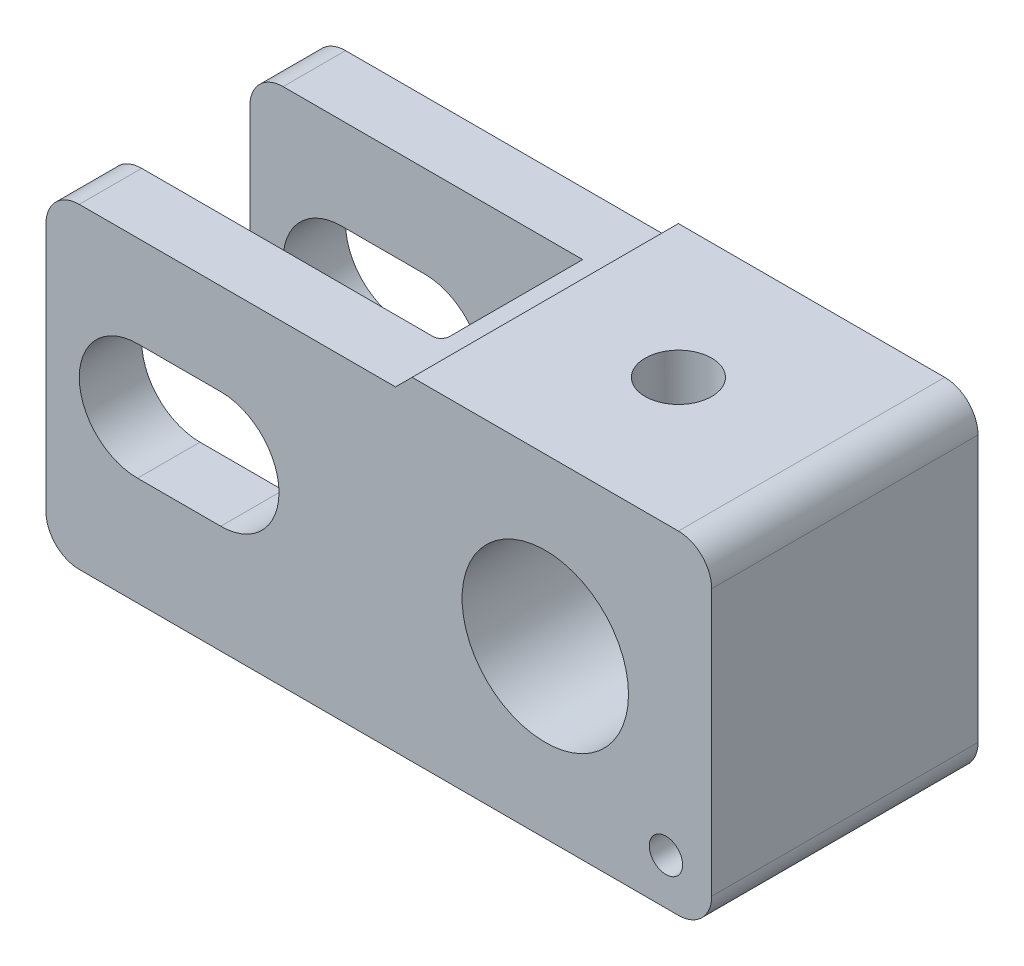
from build123d import *

# Parameters (mm, degrees)
SKETCH_1_R          = 5
EXTRUDE_1_DEPTH     = 8
CHAMFER_1_SIZE      = 1
FILLET_1_R          = 2
SKETCH_2_W          = 20
SKETCH_2_H          = 8.5
CUT_EXTRUDE_1_DEPTH = 37.400549446
SKETCH_3_R          = 1
CUT_EXTRUDE_2_DEPTH = 36.440090293
FILLET_2_R          = 0.5
SKETCH_4_R          = 2
CUT_EXTRUDE_3_DEPTH = 37.932370625


with BuildPart() as part:
    # 草图1 → 凸台-拉伸1 (new, symmetric)
    with BuildSketch(Plane.XY):
        Polygon((-10, -10), (10, -10), (10, 10), (-8, 10), (-8, 9), (-10, 9), (-30, 9), (-30, -10), align=None)
        Circle(SKETCH_1_R, mode=Mode.SUBTRACT)
        with BuildLine():
            Line((-24.5, 3.5), (-19.5, 3.5))
            ThreePointArc((-19.5, 3.5), (-16, 0), (-19.5, -3.5))
            Line((-19.5, -3.5), (-24.5, -3.5))
            ThreePointArc((-24.5, -3.5), (-28, 0), (-24.5, 3.5))
        make_face(mode=Mode.SUBTRACT)
    extrude(amount=EXTRUDE_1_DEPTH, both=True)

    # 倒角1
    chamfer_1_edges = [part.edges().sort_by_distance(p)[0] for p in [
        (-8, 9, 0),
    ]]
    chamfer(chamfer_1_edges, length=CHAMFER_1_SIZE - 0.0001)  # a hair under: the kernel refuses the full size

    # 圆角1
    fillet_1_edges = [part.edges().sort_by_distance(p)[0] for p in [
        (10, -10, 0),
        (-30, -10, 0),
        (-30, 9, 0),
        (10, 10, 0),
    ]]
    fillet(fillet_1_edges, radius=FILLET_1_R)

    # 草图2 → 切除-拉伸1 (cut, through all)
    with BuildSketch(Plane(origin=(0, 9, 0), x_dir=(1, 0, 0), z_dir=(0, 1, 0))):
        with Locations((-20, 0)):
            Rectangle(SKETCH_2_W, SKETCH_2_H)
    extrude(amount=-CUT_EXTRUDE_1_DEPTH, mode=Mode.SUBTRACT)

    # 草图3 → 切除-拉伸2 (cut, through all)
    with BuildSketch(Plane.XY.offset(8)):
        with Locations((7.25, -7.25)):
            Circle(SKETCH_3_R)
    extrude(amount=-CUT_EXTRUDE_2_DEPTH, mode=Mode.SUBTRACT)

    # 圆角2
    fillet_2_edges = [part.edges().sort_by_distance(p)[0] for p in [
        (-10, -0.5, 4.25),
    ]]
    fillet(fillet_2_edges, radius=FILLET_2_R)

    # 草图4 → 切除-拉伸3 (cut, through all)
    with BuildSketch(Plane(origin=(0, 10, 0), x_dir=(1, 0, 0), z_dir=(0, 1, 0))):
        with Locations(Location((0, 0, 0), (0, 0, 180))):
            Circle(SKETCH_4_R)
    extrude(amount=-CUT_EXTRUDE_3_DEPTH, mode=Mode.SUBTRACT)


solid = part.part
